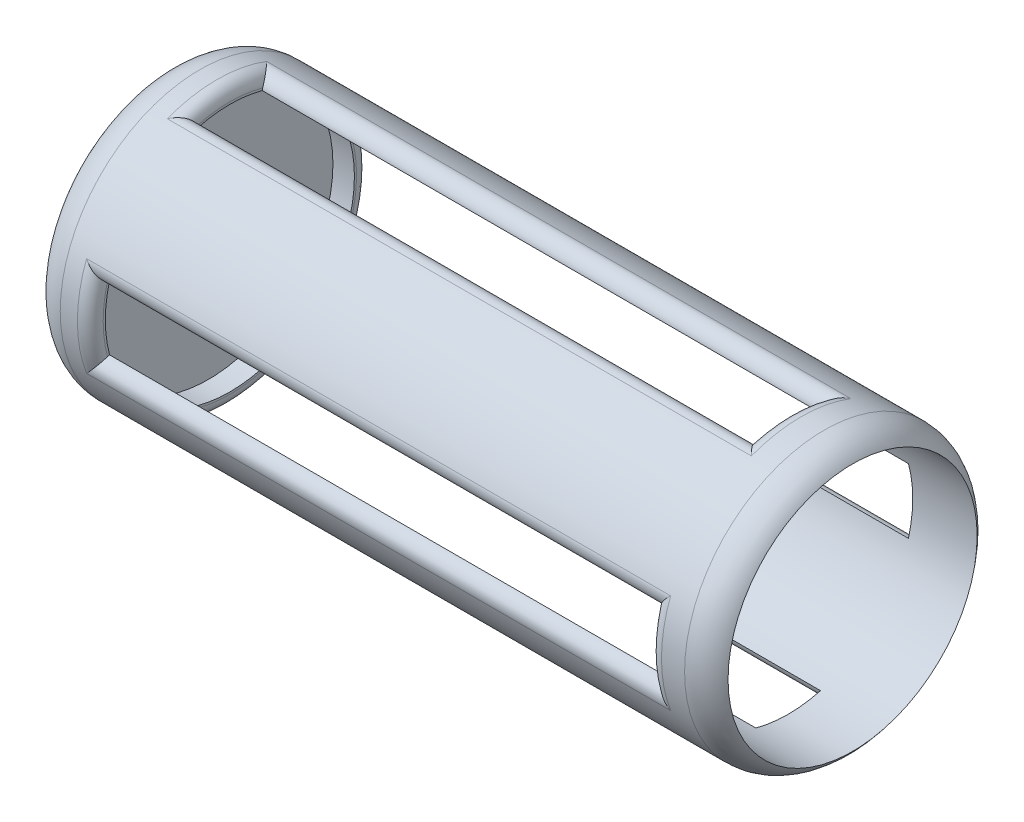
from build123d import *

# Parameters (mm, degrees)
SKETCH2_R               = 32.5
BOSS_EXTRUDE1_DEPTH     = 160
CUT_EXTRUDE2_DEPTH      = 50
CUT_EXTRUDE2_DEPTH_BACK = 50
SKETCH4_W               = 130
SKETCH4_H               = 15
CUT_EXTRUDE3_DEPTH      = 50
CUT_EXTRUDE3_DEPTH_BACK = 50
SKETCH5_W               = 130
SKETCH5_H               = 15
FILLET2_START           = 11.9999999
FILLET2_DEPTH           = 136.0000002
SKETCH6_R               = 29
CUT_EXTRUDE4_DEPTH      = 160
FILLET3_R               = 8


with BuildPart() as part:
    # Sketch2 → Boss-Extrude1 (new body)
    with BuildSketch(Plane(origin=(0, 0, 0), x_dir=(0, 0, -1), z_dir=(1, 0, 0))):
        Circle(SKETCH2_R)
    extrude(amount=BOSS_EXTRUDE1_DEPTH)

    # Sketch4 → Cut-Extrude2 (cut, two sides: drawn at the far end of the back side and taken through both)
    with BuildSketch(Plane.XY.offset(-CUT_EXTRUDE2_DEPTH_BACK)):
        with Locations((80, 0)):
            Rectangle(SKETCH4_W, SKETCH4_H)
    extrude(amount=CUT_EXTRUDE2_DEPTH + CUT_EXTRUDE2_DEPTH_BACK, mode=Mode.SUBTRACT)

    # Sketch5 → Cut-Extrude3 (cut, two sides: drawn at the far end of the back side and taken through both)
    with BuildSketch(Plane(origin=(0, 0, 0), x_dir=(1, 0, 0), z_dir=(0, 1, 0)).offset(-CUT_EXTRUDE3_DEPTH_BACK)):
        with Locations((80, 0)):
            Rectangle(SKETCH5_W, SKETCH5_H)
    extrude(amount=CUT_EXTRUDE3_DEPTH + CUT_EXTRUDE3_DEPTH_BACK, mode=Mode.SUBTRACT)

    # Fillet2: read off the stored shape, not the designer's step
    # Fillet2 outline → Fillet2 (cut)
    with BuildSketch(Plane.YZ.offset(FILLET2_START)):
        with BuildLine():
            ThreePointArc((-30.371632844, 11.56779661), (-32.5, 0), (-30.371632844, -11.56779661))
            ThreePointArc((-30.371632844, -11.56779661), (-30.038258413, -8.79755908), (-27.568097504, -7.5))
            Line((-27.568097504, -7.5), (-7.5, -7.5))
            Line((-7.5, -7.5), (-7.5, -27.568097504))
            ThreePointArc((-7.5, -27.568097504), (-8.79755908, -30.038258413), (-11.56779661, -30.371632844))
            ThreePointArc((-11.56779661, -30.371632844), (0, -32.5), (11.56779661, -30.371632844))
            ThreePointArc((11.56779661, -30.371632844), (8.79755908, -30.038258413), (7.5, -27.568097504))
            Line((7.5, -27.568097504), (7.5, -7.5))
            Line((7.5, -7.5), (27.568097504, -7.5))
            ThreePointArc((27.568097504, -7.5), (30.038258413, -8.79755908), (30.371632844, -11.56779661))
            ThreePointArc((30.371632844, -11.56779661), (32.5, 0), (30.371632844, 11.56779661))
            ThreePointArc((30.371632844, 11.56779661), (30.038258413, 8.79755908), (27.568097504, 7.5))
            Line((27.568097504, 7.5), (7.5, 7.5))
            Line((7.5, 7.5), (7.5, 27.568097504))
            ThreePointArc((7.5, 27.568097504), (8.79755908, 30.038258413), (11.56779661, 30.371632844))
            ThreePointArc((11.56779661, 30.371632844), (0, 32.5), (-11.56779661, 30.371632844))
            ThreePointArc((-11.56779661, 30.371632844), (-8.79755908, 30.038258413), (-7.5, 27.568097504))
            Line((-7.5, 27.568097504), (-7.5, 7.5))
            Line((-7.5, 7.5), (-27.568097504, 7.5))
            ThreePointArc((-27.568097504, 7.5), (-30.038258413, 8.79755908), (-30.371632844, 11.56779661))
        make_face()
    extrude(amount=FILLET2_DEPTH, mode=Mode.SUBTRACT)

    # Fillet2 2 outline → Fillet2 2 (revolve)
    with BuildSketch(Plane.YX):
        with BuildLine():
            Line((0, 148.0000001), (0, 145))
            Line((0, 145), (29.5, 145))
            ThreePointArc((29.5, 145), (31.621320344, 145.878679656), (32.5, 148))
            Line((32.5, 148), (0, 148.0000001))
        make_face()
        with BuildLine():
            Line((29.5, 15), (0, 15))
            Line((0, 15), (0, 11.9999999))
            Line((0, 11.9999999), (32.5, 12))
            ThreePointArc((32.5, 12), (31.621320344, 14.121320344), (29.5, 15))
        make_face()
    revolve(axis=Axis((0, 0, 0), (1, 0, 0)))

    # Sketch6 → Cut-Extrude4 (cut)
    with BuildSketch(Plane(origin=(170, 0, 0), x_dir=(0, 0, -1), z_dir=(1, 0, 0))):
        Circle(SKETCH6_R)
    extrude(amount=-CUT_EXTRUDE4_DEPTH, mode=Mode.SUBTRACT)

    # Fillet3
    # the kernel refuses this fillet: 8 mm, written as the material it takes off along each edge
    with BuildSketch(Plane(origin=(0, 0, 0), x_dir=(0, 0, -1), z_dir=(0, -1, 0))) as fillet3_piece_1:
        with BuildLine():
            CenterArc((32.5 - FILLET3_R, FILLET3_R), FILLET3_R, 270, 90)
            Line((32.5 - FILLET3_R, 0), (32.5 - FILLET3_R, -FILLET3_R * 0.02))
            Line((32.5 - FILLET3_R, -FILLET3_R * 0.02), (32.5 + FILLET3_R * 0.02, -FILLET3_R * 0.02))
            Line((32.5 + FILLET3_R * 0.02, -FILLET3_R * 0.02), (32.5 + FILLET3_R * 0.02, FILLET3_R))
            Line((32.5 + FILLET3_R * 0.02, FILLET3_R), (32.5, FILLET3_R))
        make_face()
    revolve(axis=Axis((0, 0, 0), (1, 0, 0)), mode=Mode.SUBTRACT)
    with BuildSketch(Plane(origin=(160, 0, 0), x_dir=(0, 0, -1), z_dir=(0, -1, 0))) as fillet3_piece_2:
        with BuildLine():
            CenterArc((24.5, -6.614378278), FILLET3_R, 0, 55.771133672)
            Line((29, 0), (29.09, 0.132287566))
            ThreePointArc((29.09, 0.132287566), (30.75, 0.16), (32.5, 0.16))
            Line((32.5, 0.16), (32.66, 0))
            Line((32.66, 0), (32.66, -6.614378278))
            Line((32.66, -6.614378278), (32.5, -6.614378278))
        make_face()
    revolve(axis=Axis((160, 0, 0), (1, 0, 0)), mode=Mode.SUBTRACT)


solid = part.part
